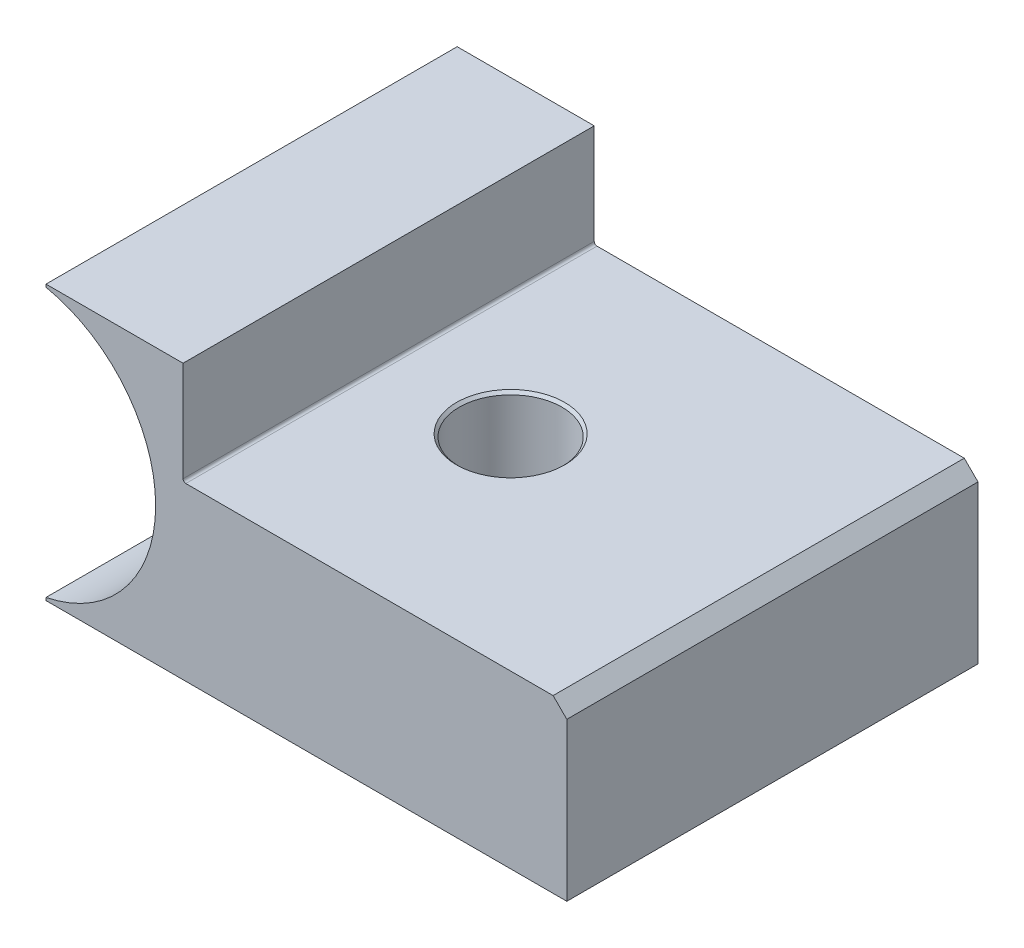
from build123d import *

# Parameters (mm, degrees)
BOSS_EXTRUDE1_DEPTH          = 38.1
F_3_8_0_375_DIAMETER_HOLE1_D = 9.525
CHAMFER1_SIZE                = 1.27
CHAMFER2_SIZE                = 0.254
FILLET1_R                    = 0.254


with BuildPart() as part:
    # Sketch1 → Boss-Extrude1 (new body)
    with BuildSketch(Plane.XY):
        with BuildLine():
            Line((2.54, 0), (50.8, 0))
            Line((50.8, 0), (50.8, 15.875))
            Line((50.8, 15.875), (15.24, 15.875))
            Line((15.24, 15.875), (15.24, 25.4))
            Line((15.24, 25.4), (2.54, 25.4))
            Line((2.54, 25.4), (2.54, 25.143407893))
            ThreePointArc((2.54, 25.143407893), (12.7, 12.7), (2.54, 0.256592107))
            Line((2.54, 0.256592107), (2.54, 0))
        make_face()
    extrude(amount=BOSS_EXTRUDE1_DEPTH)

    # 3/8 (0.375) Diameter Hole1 (through all)
    with Locations(Plane(origin=(0, 15.875, 0), x_dir=(1, 0, 0), z_dir=(0, 1, 0))):
        with Locations((26.543, -19.05)):
            Hole(F_3_8_0_375_DIAMETER_HOLE1_D / 2)

    # Chamfer1
    chamfer1_edges = [part.edges().sort_by_distance(p)[0] for p in [
        (50.8, 15.875, 19.05),
    ]]
    chamfer(chamfer1_edges, length=CHAMFER1_SIZE)

    # Chamfer2
    chamfer2_edges = [part.edges().sort_by_distance(p)[0] for p in [
        (31.3055, 15.875, 19.05),
    ]]
    chamfer(chamfer2_edges, length=CHAMFER2_SIZE)

    # Fillet1
    fillet1_edges = [part.edges().sort_by_distance(p)[0] for p in [
        (15.24, 15.875, 19.05),
    ]]
    fillet(fillet1_edges, radius=FILLET1_R)


solid = part.part
